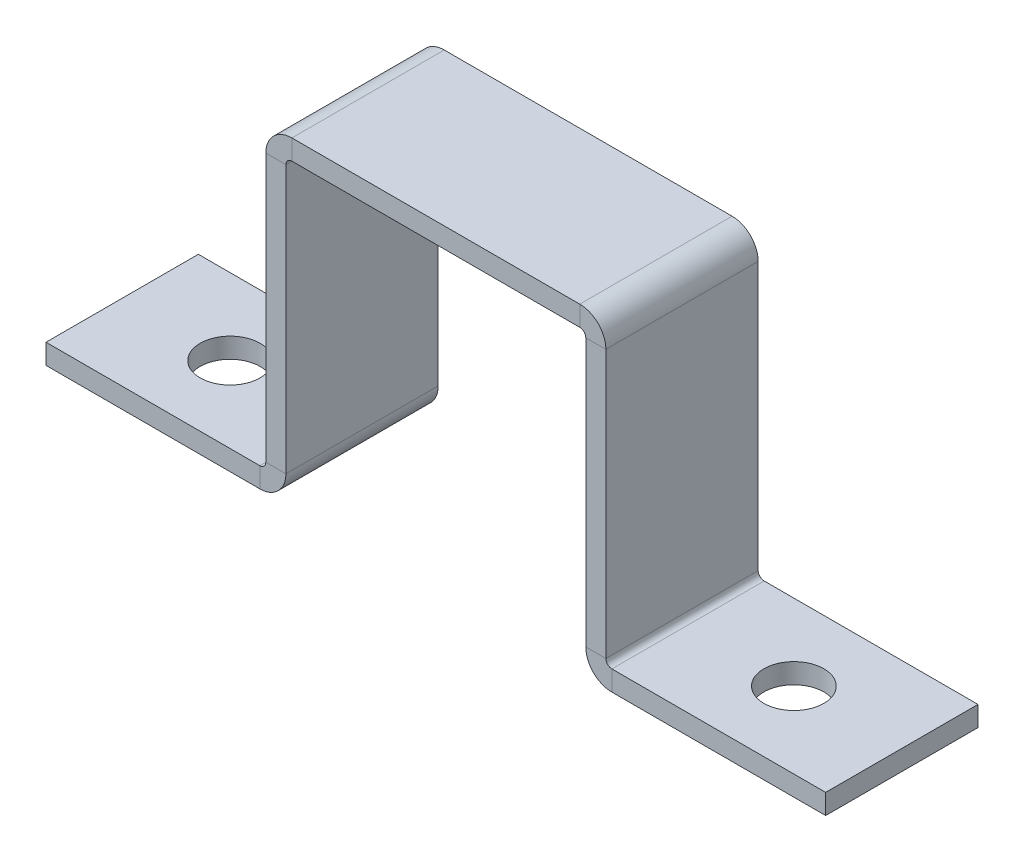
from build123d import *

# Parameters (mm, degrees)
FLANGE_BASE1_DEPTH    = 12.7
ESBO_O3_R             = 5
CORTE_EXTRUS_O1_DEPTH = 10


# Sheet-metal steps are written as plain solids
with BuildPart() as part:
    # Esboço1 → Flange-base1 (new, symmetric)
    with BuildSketch(Plane.XY):
        with BuildLine():
            Line((-65, 0), (-29.35, 0))
            ThreePointArc((-29.35, 0), (-26.274085502, 1.274085502), (-25, 4.35))
            Line((-25, 4.35), (-25, 49))
            ThreePointArc((-25, 49), (-24.707106781, 49.707106781), (-24, 50))
            Line((-24, 50), (24, 50))
            ThreePointArc((24, 50), (24.707106781, 49.707106781), (25, 49))
            Line((25, 49), (25, 4.35))
            ThreePointArc((25, 4.35), (26.274085502, 1.274085502), (29.35, 0))
            Line((29.35, 0), (65, 0))
            Line((65, 0), (65, 3.35))
            Line((65, 3.35), (29.35, 3.35))
            ThreePointArc((29.35, 3.35), (28.642893219, 3.642893219), (28.35, 4.35))
            Line((28.35, 4.35), (28.35, 49))
            ThreePointArc((28.35, 49), (27.075914498, 52.075914498), (24, 53.35))
            Line((24, 53.35), (-24, 53.35))
            ThreePointArc((-24, 53.35), (-27.075914498, 52.075914498), (-28.35, 49))
            Line((-28.35, 49), (-28.35, 4.35))
            ThreePointArc((-28.35, 4.35), (-28.642893219, 3.642893219), (-29.35, 3.35))
            Line((-29.35, 3.35), (-65, 3.35))
            Line((-65, 3.35), (-65, 0))
        make_face()
    extrude(amount=FLANGE_BASE1_DEPTH, both=True)

    # Esboço3 → Corte-extrusão1 (cut)
    with BuildSketch(Plane.XZ):
        with Locations((47, 0)):
            Circle(ESBO_O3_R)
        with Locations(Location((-47, 0, 0), (0, 0, 180))):
            Circle(ESBO_O3_R)
    extrude(amount=-CORTE_EXTRUS_O1_DEPTH, mode=Mode.SUBTRACT)


solid = part.part
